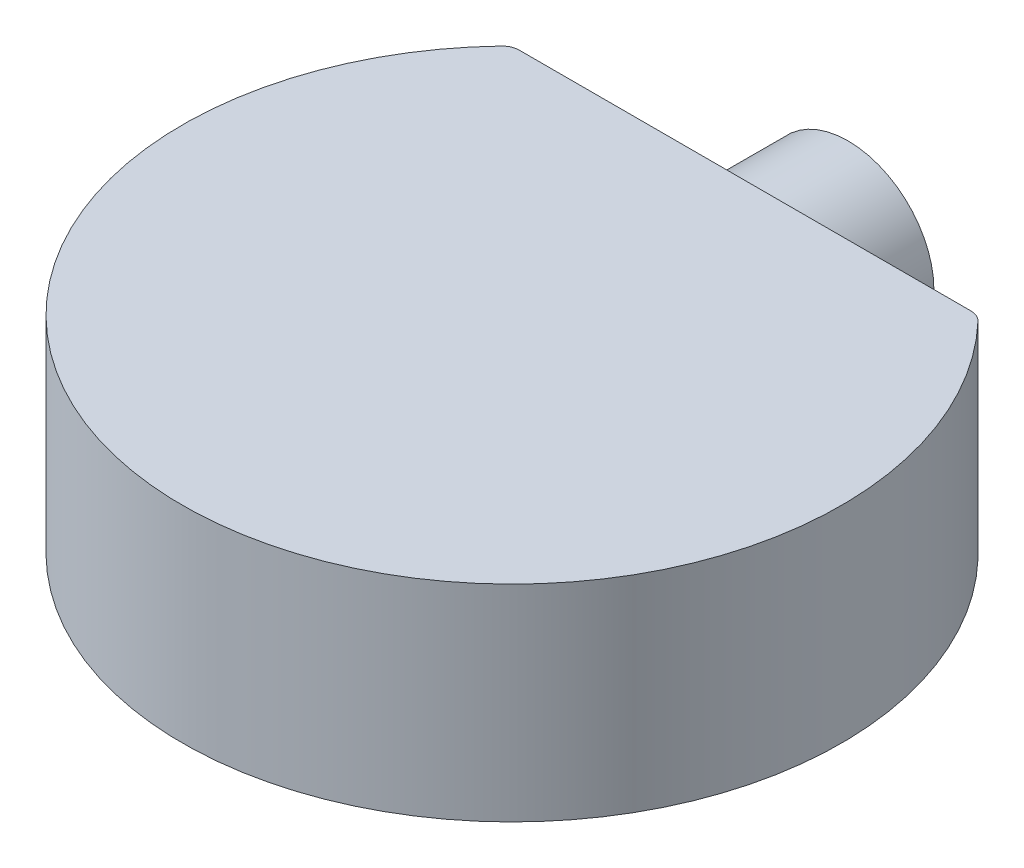
from build123d import *

# Parameters (mm, degrees)
BOSS_EXTRUDE4_DEPTH = 1.5
SKETCH6_R           = 1.25
SKETCH6_R_2         = 1
SKETCH6_R_3         = 0.5
SKETCH6_R_4         = 0.25
BOSS_EXTRUDE6_DEPTH = 1.5
FILLET2_R           = 0.25


with BuildPart() as part:
    # Sketch3 → Boss-Extrude4 (new, symmetric)
    with BuildSketch(Plane(origin=(0, 0, 0), x_dir=(1, 0, 0), z_dir=(0, 1, 0))):
        with BuildLine():
            Line((-3.39411255, 3.39411255), (3.39411255, 3.39411255))
            ThreePointArc((3.39411255, 3.39411255), (0, -4.8), (-3.39411255, 3.39411255))
        make_face()
    extrude(amount=BOSS_EXTRUDE4_DEPTH, both=True)

    # Sketch6 → Boss-Extrude6 (add)
    # profile 1 of 2: a face of its own
    with BuildSketch(Plane(origin=(0, 0, -3.39411255), x_dir=(-1, 0, 0), z_dir=(0, 0, -1))):
        Circle(SKETCH6_R)
        Circle(SKETCH6_R_2, mode=Mode.SUBTRACT)
    # profile 2 of 2: a face of its own
    with BuildSketch(Plane(origin=(0, 0, -3.39411255), x_dir=(-1, 0, 0), z_dir=(0, 0, -1))):
        Circle(SKETCH6_R_3)
        Circle(SKETCH6_R_4, mode=Mode.SUBTRACT)
    extrude(amount=BOSS_EXTRUDE6_DEPTH)

    # Fillet2
    fillet2_edges = [part.edges().sort_by_distance(p)[0] for p in [
        (3.39411255, 0, -3.39411255),
        (-3.39411255, 0, -3.39411255),
    ]]
    fillet(fillet2_edges, radius=FILLET2_R)


solid = part.part
